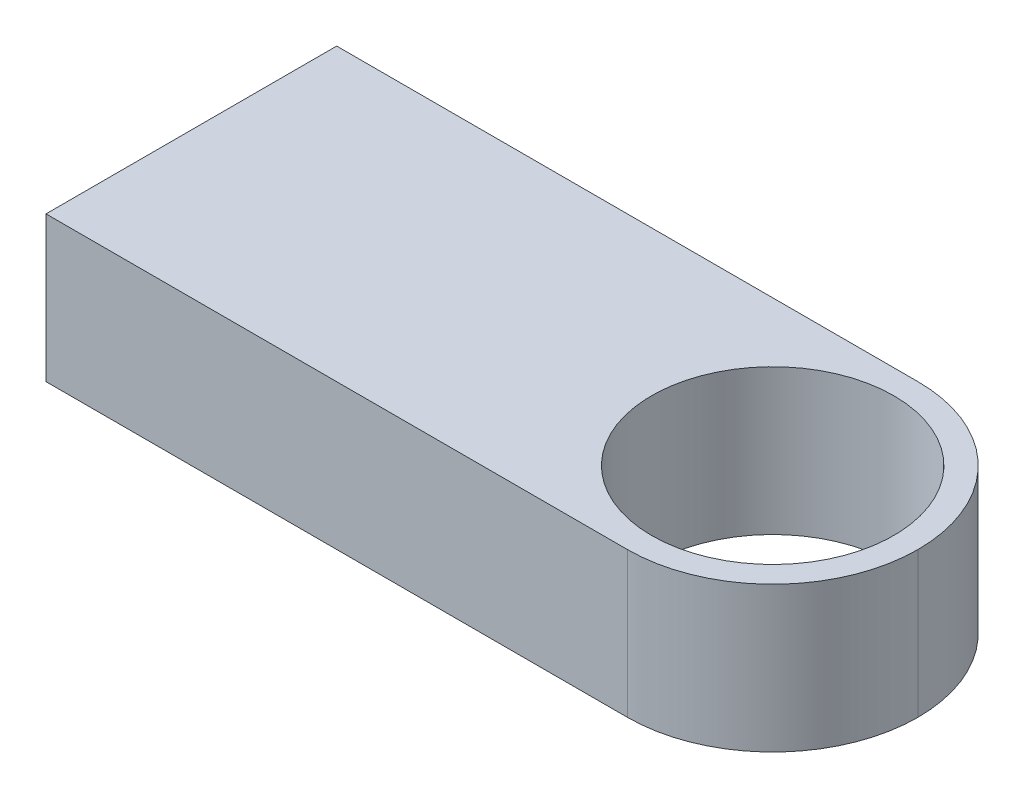
from build123d import *

# Parameters (mm, degrees)
SKETCH1_W           = 60
SKETCH1_H           = 30
BOSS_EXTRUDE1_DEPTH = 150
SKETCH2_R           = 25
CUT_EXTRUDE1_DEPTH  = 30
FILLET1_R           = 30


with BuildPart() as part:
    # Sketch1 → Boss-Extrude1 (new body)
    with BuildSketch(Plane(origin=(0, 0, 0), x_dir=(0, 0, -1), z_dir=(1, 0, 0))):
        Rectangle(SKETCH1_W, SKETCH1_H)
    extrude(amount=BOSS_EXTRUDE1_DEPTH)

    # Sketch2 → Cut-Extrude1 (cut)
    with BuildSketch(Plane(origin=(0, 15, 0), x_dir=(1, 0, 0), z_dir=(0, 1, 0))):
        with Locations(Location((120, 0, 0), (0, 0, 270))):
            Circle(SKETCH2_R)
    extrude(amount=-CUT_EXTRUDE1_DEPTH, mode=Mode.SUBTRACT)

    # Fillet1
    fillet1_edges = [part.edges().sort_by_distance(p)[0] for p in [
        (150, 0, -30),
        (150, 0, 30),
    ]]
    fillet(fillet1_edges, radius=FILLET1_R - 0.0001)  # a hair under: the kernel refuses the full size


solid = part.part
